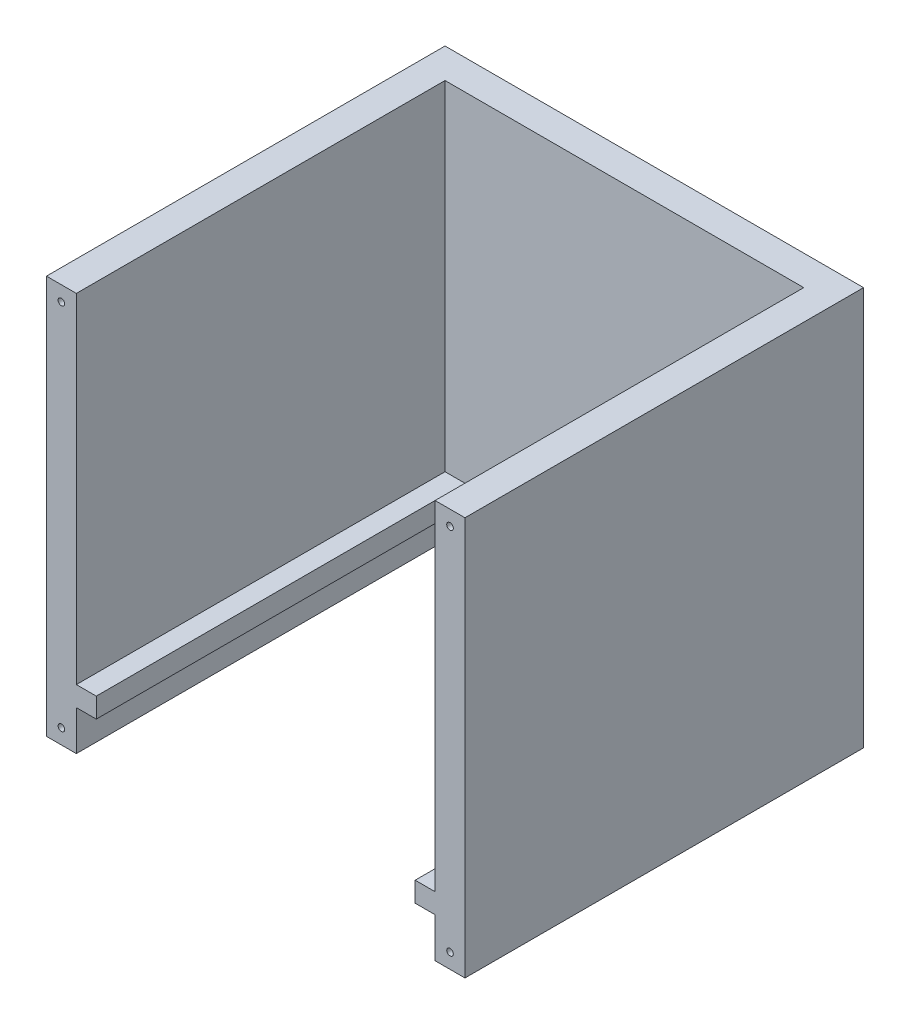
from build123d import *

# Parameters (mm, degrees)
BOSS_EXTRUDE1_DEPTH = 200
BOSS_EXTRUDE2_DEPTH = 10
SKETCH5_R           = 1.65
CUT_EXTRUDE1_DEPTH  = 10


with BuildPart() as part:
    # Sketch2 → Boss-Extrude1 (new body)
    with BuildSketch(Plane(origin=(0, 0, 0), x_dir=(1, 0, 0), z_dir=(0, 1, 0))):
        Polygon((-90, 0), (90, 0), (90, -185), (105, -185), (105, 15), (-105, 15), (-105, -185), (-90, -185), align=None)
    extrude(amount=BOSS_EXTRUDE1_DEPTH)

    # Sketch3 → Boss-Extrude2 (add)
    with BuildSketch(Plane(origin=(0, 30, 0), x_dir=(1, 0, 0), z_dir=(0, 1, 0))):
        Polygon((-90, -185), (-80, -185), (-80, -10), (80, -10), (80, -185), (90, -185), (90, 0), (-90, 0), align=None)
    extrude(amount=-BOSS_EXTRUDE2_DEPTH)

    # Sketch5 → Cut-Extrude1 (cut)
    with BuildSketch(Plane.XY.offset(185)):
        with Locations((-97.5, 192.5)):
            Circle(SKETCH5_R)
        with Locations((97.5, 192.5)):
            Circle(SKETCH5_R)
        with Locations((-97.5, 7.5)):
            Circle(SKETCH5_R)
        with Locations((97.5, 7.5)):
            Circle(SKETCH5_R)
    extrude(amount=-CUT_EXTRUDE1_DEPTH, mode=Mode.SUBTRACT)


solid = part.part
